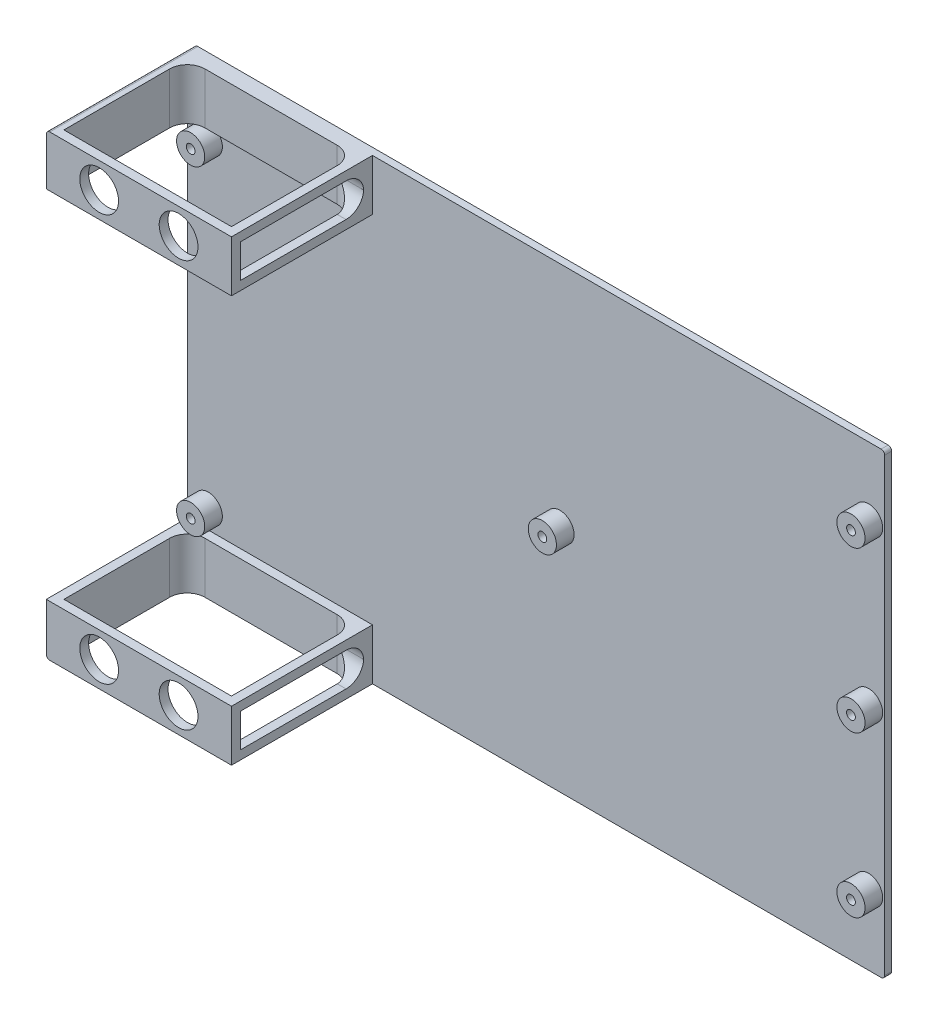
from build123d import *

# Parameters (mm, degrees)
SKETCH2_W                   = 197.834
SKETCH2_H                   = 129.822
BOSS_EXTRUDE1_DEPTH         = 2
SKETCH3_R                   = 4
BOSS_EXTRUDE2_DEPTH         = 5
TAP_DRILL_FOR_M3X0_5_TAP1_D = 2.5
SKETCH9_W                   = 52.531921718
SKETCH9_H                   = 14.5
BOSS_EXTRUDE3_DEPTH         = 40
CUT_EXTRUDE1_START          = -2.5
SKETCH11_W                  = 47.531921718
SKETCH11_H                  = 9.5
SKETCH11_H_2                = 2.5
SKETCH11_W_2                = 2.5
CUT_EXTRUDE1_DEPTH          = 35
CUT_EXTRUDE2_REACH          = 259.475
SKETCH12_R                  = 5.5
FILLET1_R                   = 5
FILLET1_OF_MIRROR1_R        = 5
FILLET2_R                   = 1


with BuildPart() as part:
    # Sketch2 → Boss-Extrude1 (new body)
    with BuildSketch(Plane(origin=(0, 0, 134.499543387), x_dir=(-1, 0, 0), z_dir=(0, 0, -1))):
        with Locations((-86.183818981, 109.06399149)):
            Rectangle(SKETCH2_W, SKETCH2_H)
    extrude(amount=BOSS_EXTRUDE1_DEPTH)

    # Sketch3 → Boss-Extrude2 (add)
    with BuildSketch(Plane.XY.offset(134.499543387)):
        with Locations((180.544818981, 154.78399149)):
            Circle(SKETCH3_R)
        with Locations((180.544818981, 109.38149149)):
            Circle(SKETCH3_R)
        with Locations((180.544818981, 63.97899149)):
            Circle(SKETCH3_R)
        with Locations((92.991018981, 109.38149149)):
            Circle(SKETCH3_R)
        with Locations((-6.780181019, 154.78399149)):
            Circle(SKETCH3_R)
        with Locations((-6.780181019, 63.97899149)):
            Circle(SKETCH3_R)
    extrude(amount=BOSS_EXTRUDE2_DEPTH)

    # Tap Drill for M3x0.5 Tap1 (through all)
    with Locations(Plane.XY.offset(139.499543387)):
        with Locations((180.544818981, 154.78399149), (180.544818981, 109.38149149), (180.544818981, 63.97899149), (92.991018981, 109.38149149), (-6.780181019, 63.97899149), (-6.780181019, 154.78399149)):
            Hole(TAP_DRILL_FOR_M3X0_5_TAP1_D / 2)

    # Sketch9 → Boss-Extrude3 (add)
    with BuildSketch(Plane.XY.offset(134.499543387)):
        with Locations((13.53277984, 166.72499149)):
            Rectangle(SKETCH9_W, SKETCH9_H)
    boss_extrude3 = extrude(amount=BOSS_EXTRUDE3_DEPTH)

    # Sketch11 → Cut-Extrude1 (cut)
    with BuildSketch(Plane.XY.offset(174.499543387).offset(CUT_EXTRUDE1_START)):
        with Locations((13.53277984, 166.72499149)):
            Rectangle(SKETCH11_W, SKETCH11_H)
        with Locations((13.53277984, 160.72499149)):
            Rectangle(SKETCH11_W, SKETCH11_H_2)
        with Locations((13.53277984, 172.72499149)):
            Rectangle(SKETCH11_W, SKETCH11_H_2)
        with Locations((38.548740699, 166.72499149)):
            Rectangle(SKETCH11_W_2, SKETCH11_H)
    cut_extrude1 = extrude(amount=-CUT_EXTRUDE1_DEPTH, mode=Mode.SUBTRACT)

    # Sketch12 → Cut-Extrude2 (cut, up to next)
    with BuildSketch(Plane.XY.offset(174.499543387), mode=Mode.PRIVATE) as cut_extrude2_sk1:
        with Locations((2.266818981, 166.72499149)):
            Circle(SKETCH12_R)
    cut_extrude2_tool1 = extrude(cut_extrude2_sk1.sketch, amount=-CUT_EXTRUDE2_REACH, mode=Mode.PRIVATE) & part.part
    # Sketch12 → Cut-Extrude2 (cut, up to next)
    with BuildSketch(Plane.XY.offset(174.499543387), mode=Mode.PRIVATE) as cut_extrude2_sk2:
        with Locations((24.798740699, 166.72499149)):
            Circle(SKETCH12_R)
    cut_extrude2_tool2 = extrude(cut_extrude2_sk2.sketch, amount=-CUT_EXTRUDE2_REACH, mode=Mode.PRIVATE) & part.part
    cut_extrude2_1 = cut_extrude2_tool1.solids().sort_by_distance((2.266819, 166.724991, 174.499543))[0]
    add(cut_extrude2_1, mode=Mode.SUBTRACT)
    cut_extrude2_2 = cut_extrude2_tool2.solids().sort_by_distance((24.798741, 166.724991, 174.499543))[0]
    add(cut_extrude2_2, mode=Mode.SUBTRACT)
    cut_extrude2 = cut_extrude2_1 + cut_extrude2_2  # Cut-Extrude2 as one shape, for the pattern or mirror that repeats it

    # Fillet1
    # the kernel refuses this fillet: 5 mm, written as the material it adds along each edge
    with BuildSketch(Plane(origin=(-10.233181019, 159.47499149, 136.999543387), x_dir=(0, 0, 1), z_dir=(0, 1, 0))) as fillet1_piece_1:
        with BuildLine():
            CenterArc((FILLET1_R, FILLET1_R), FILLET1_R, 180, 90)
            Line((0, FILLET1_R), (-FILLET1_R * 0.02, FILLET1_R))
            Line((-FILLET1_R * 0.02, FILLET1_R), (-FILLET1_R * 0.02, -FILLET1_R * 0.02))
            Line((-FILLET1_R * 0.02, -FILLET1_R * 0.02), (FILLET1_R, -FILLET1_R * 0.02))
            Line((FILLET1_R, -FILLET1_R * 0.02), (FILLET1_R, 0))
        make_face()
    extrude(amount=14.5)
    with BuildSketch(Plane(origin=(39.798740699, 171.47499149, 136.999543387), x_dir=(0, -1, 0), z_dir=(-1, 0, 0)), Plane(origin=(37.298740699, 171.47499149, 136.999543387), x_dir=(-1, 0, 0), z_dir=(0, 1, 0)), Plane(origin=(37.298740699, 161.97499149, 136.999543387), x_dir=(0, 1, 0), z_dir=(1, 0, 0)), Plane(origin=(37.298740699, 159.47499149, 136.999543387), x_dir=(-1, 0, 0), z_dir=(0, 1, 0))) as fillet1_piece_2:
        with BuildLine():
            CenterArc((FILLET1_R, FILLET1_R), FILLET1_R, 180, 90)
            Line((0, FILLET1_R), (-FILLET1_R * 0.02, FILLET1_R))
            Line((-FILLET1_R * 0.02, FILLET1_R), (-FILLET1_R * 0.02, -FILLET1_R * 0.02))
            Line((-FILLET1_R * 0.02, -FILLET1_R * 0.02), (FILLET1_R, -FILLET1_R * 0.02))
            Line((FILLET1_R, -FILLET1_R * 0.02), (FILLET1_R, 0))
        make_face()
    extrude(amount=2.5)
    with BuildSketch(Plane(origin=(39.798740699, 171.47499149, 136.999543387), x_dir=(0, -1, 0), z_dir=(-1, 0, 0))) as fillet1_piece_3a_section:
        with BuildLine():
            CenterArc((FILLET1_R, FILLET1_R), FILLET1_R, 180, 90)
            Line((0, FILLET1_R), (-FILLET1_R * 0.02, FILLET1_R))
            Line((-FILLET1_R * 0.02, FILLET1_R), (-FILLET1_R * 0.02, -FILLET1_R * 0.02))
            Line((-FILLET1_R * 0.02, -FILLET1_R * 0.02), (FILLET1_R, -FILLET1_R * 0.02))
            Line((FILLET1_R, -FILLET1_R * 0.02), (FILLET1_R, 0))
        make_face()
    fillet1_piece_3a = extrude(amount=15, mode=Mode.PRIVATE)
    fillet1_piece_3a = split(fillet1_piece_3a, bisect_by=Plane(origin=(37.298740699, 170.343015918, 138.131518958), z_dir=(-1, 0, 0)), keep=Keep.TOP, mode=Mode.PRIVATE)
    with BuildSketch(Plane(origin=(37.298740699, 158.97499149, 136.999543387), x_dir=(-1, 0, 0), z_dir=(0, 1, 0))) as fillet1_piece_3b_section:
        with BuildLine():
            CenterArc((FILLET1_R, FILLET1_R), FILLET1_R, 180, 90)
            Line((0, FILLET1_R), (-FILLET1_R * 0.02, FILLET1_R))
            Line((-FILLET1_R * 0.02, FILLET1_R), (-FILLET1_R * 0.02, -FILLET1_R * 0.02))
            Line((-FILLET1_R * 0.02, -FILLET1_R * 0.02), (FILLET1_R, -FILLET1_R * 0.02))
            Line((FILLET1_R, -FILLET1_R * 0.02), (FILLET1_R, 0))
        make_face()
    fillet1_piece_3b = extrude(amount=15, mode=Mode.PRIVATE)
    fillet1_piece_3b = split(fillet1_piece_3b, bisect_by=Plane(origin=(36.166765127, 171.47499149, 138.131518958), z_dir=(0, -1, 0)), keep=Keep.TOP, mode=Mode.PRIVATE)
    fillet1_piece_3 = fillet1_piece_3a & fillet1_piece_3b
    add(fillet1_piece_3)
    with BuildSketch(Plane(origin=(37.298740699, 159.47499149, 136.999543387), x_dir=(-1, 0, 0), z_dir=(0, 1, 0))) as fillet1_piece_4a_section:
        with BuildLine():
            CenterArc((FILLET1_R, FILLET1_R), FILLET1_R, 180, 90)
            Line((0, FILLET1_R), (-FILLET1_R * 0.02, FILLET1_R))
            Line((-FILLET1_R * 0.02, FILLET1_R), (-FILLET1_R * 0.02, -FILLET1_R * 0.02))
            Line((-FILLET1_R * 0.02, -FILLET1_R * 0.02), (FILLET1_R, -FILLET1_R * 0.02))
            Line((FILLET1_R, -FILLET1_R * 0.02), (FILLET1_R, 0))
        make_face()
    fillet1_piece_4a = extrude(amount=15, mode=Mode.PRIVATE)
    fillet1_piece_4a = split(fillet1_piece_4a, bisect_by=Plane(origin=(36.166765127, 161.97499149, 138.131518958), z_dir=(0, 1, 0)), keep=Keep.TOP, mode=Mode.PRIVATE)
    with BuildSketch(Plane(origin=(24.798740699, 161.97499149, 136.999543387), x_dir=(0, 1, 0), z_dir=(1, 0, 0))) as fillet1_piece_4b_section:
        with BuildLine():
            CenterArc((FILLET1_R, FILLET1_R), FILLET1_R, 180, 90)
            Line((0, FILLET1_R), (-FILLET1_R * 0.02, FILLET1_R))
            Line((-FILLET1_R * 0.02, FILLET1_R), (-FILLET1_R * 0.02, -FILLET1_R * 0.02))
            Line((-FILLET1_R * 0.02, -FILLET1_R * 0.02), (FILLET1_R, -FILLET1_R * 0.02))
            Line((FILLET1_R, -FILLET1_R * 0.02), (FILLET1_R, 0))
        make_face()
    fillet1_piece_4b = extrude(amount=15, mode=Mode.PRIVATE)
    fillet1_piece_4b = split(fillet1_piece_4b, bisect_by=Plane(origin=(37.298740699, 163.106967061, 138.131518958), z_dir=(-1, 0, 0)), keep=Keep.TOP, mode=Mode.PRIVATE)
    fillet1_piece_4 = fillet1_piece_4a & fillet1_piece_4b
    add(fillet1_piece_4)

    # Mirror1: Boss-Extrude3, Cut-Extrude1, Cut-Extrude2 across plane
    add(boss_extrude3.mirror(Plane.ZX.offset(109.06399149)))
    add(cut_extrude1.mirror(Plane.ZX.offset(109.06399149)), mode=Mode.SUBTRACT)
    add(cut_extrude2.mirror(Plane.ZX.offset(109.06399149)), mode=Mode.SUBTRACT)

    # Fillet1 of Mirror1
    # the kernel refuses this fillet: 5 mm, written as the material it adds along each edge
    with BuildSketch(Plane(origin=(-10.233181019, 58.65299149, 136.999543387), x_dir=(1, 0, 0), z_dir=(0, -1, 0))) as fillet1_of_mirror1_piece_1:
        with BuildLine():
            CenterArc((FILLET1_OF_MIRROR1_R, FILLET1_OF_MIRROR1_R), FILLET1_OF_MIRROR1_R, 180, 90)
            Line((0, FILLET1_OF_MIRROR1_R), (-FILLET1_OF_MIRROR1_R * 0.02, FILLET1_OF_MIRROR1_R))
            Line((-FILLET1_OF_MIRROR1_R * 0.02, FILLET1_OF_MIRROR1_R), (-FILLET1_OF_MIRROR1_R * 0.02, -FILLET1_OF_MIRROR1_R * 0.02))
            Line((-FILLET1_OF_MIRROR1_R * 0.02, -FILLET1_OF_MIRROR1_R * 0.02), (FILLET1_OF_MIRROR1_R, -FILLET1_OF_MIRROR1_R * 0.02))
            Line((FILLET1_OF_MIRROR1_R, -FILLET1_OF_MIRROR1_R * 0.02), (FILLET1_OF_MIRROR1_R, 0))
        make_face()
    extrude(amount=14.5)
    with BuildSketch(Plane(origin=(39.798740699, 46.65299149, 136.999543387), x_dir=(0, 1, 0), z_dir=(-1, 0, 0)), Plane(origin=(37.298740699, 56.15299149, 136.999543387), x_dir=(0, -1, 0), z_dir=(1, 0, 0)), Plane(origin=(37.298740699, 58.65299149, 136.999543387), x_dir=(-1, 0, 0), z_dir=(0, -1, 0))) as fillet1_of_mirror1_piece_2:
        with BuildLine():
            CenterArc((FILLET1_OF_MIRROR1_R, -FILLET1_OF_MIRROR1_R), FILLET1_OF_MIRROR1_R, 90, 90)
            Line((0, -FILLET1_OF_MIRROR1_R), (-FILLET1_OF_MIRROR1_R * 0.02, -FILLET1_OF_MIRROR1_R))
            Line((-FILLET1_OF_MIRROR1_R * 0.02, -FILLET1_OF_MIRROR1_R), (-FILLET1_OF_MIRROR1_R * 0.02, FILLET1_OF_MIRROR1_R * 0.02))
            Line((-FILLET1_OF_MIRROR1_R * 0.02, FILLET1_OF_MIRROR1_R * 0.02), (FILLET1_OF_MIRROR1_R, FILLET1_OF_MIRROR1_R * 0.02))
            Line((FILLET1_OF_MIRROR1_R, FILLET1_OF_MIRROR1_R * 0.02), (FILLET1_OF_MIRROR1_R, 0))
        make_face()
    extrude(amount=2.5)
    with BuildSketch(Plane(origin=(37.298740699, 46.65299149, 136.999543387), x_dir=(0, 0, 1), z_dir=(0, -1, 0))) as fillet1_of_mirror1_piece_3:
        with BuildLine():
            CenterArc((FILLET1_OF_MIRROR1_R, FILLET1_OF_MIRROR1_R), FILLET1_OF_MIRROR1_R, 180, 90)
            Line((0, FILLET1_OF_MIRROR1_R), (-FILLET1_OF_MIRROR1_R * 0.02, FILLET1_OF_MIRROR1_R))
            Line((-FILLET1_OF_MIRROR1_R * 0.02, FILLET1_OF_MIRROR1_R), (-FILLET1_OF_MIRROR1_R * 0.02, -FILLET1_OF_MIRROR1_R * 0.02))
            Line((-FILLET1_OF_MIRROR1_R * 0.02, -FILLET1_OF_MIRROR1_R * 0.02), (FILLET1_OF_MIRROR1_R, -FILLET1_OF_MIRROR1_R * 0.02))
            Line((FILLET1_OF_MIRROR1_R, -FILLET1_OF_MIRROR1_R * 0.02), (FILLET1_OF_MIRROR1_R, 0))
        make_face()
    extrude(amount=2.5)
    with BuildSketch(Plane(origin=(37.298740699, 59.15299149, 136.999543387), x_dir=(0, 0, 1), z_dir=(0, -1, 0))) as fillet1_of_mirror1_piece_4a_section:
        with BuildLine():
            CenterArc((FILLET1_OF_MIRROR1_R, FILLET1_OF_MIRROR1_R), FILLET1_OF_MIRROR1_R, 180, 90)
            Line((0, FILLET1_OF_MIRROR1_R), (-FILLET1_OF_MIRROR1_R * 0.02, FILLET1_OF_MIRROR1_R))
            Line((-FILLET1_OF_MIRROR1_R * 0.02, FILLET1_OF_MIRROR1_R), (-FILLET1_OF_MIRROR1_R * 0.02, -FILLET1_OF_MIRROR1_R * 0.02))
            Line((-FILLET1_OF_MIRROR1_R * 0.02, -FILLET1_OF_MIRROR1_R * 0.02), (FILLET1_OF_MIRROR1_R, -FILLET1_OF_MIRROR1_R * 0.02))
            Line((FILLET1_OF_MIRROR1_R, -FILLET1_OF_MIRROR1_R * 0.02), (FILLET1_OF_MIRROR1_R, 0))
        make_face()
    fillet1_of_mirror1_piece_4a = extrude(amount=15, mode=Mode.PRIVATE)
    fillet1_of_mirror1_piece_4a = split(fillet1_of_mirror1_piece_4a, bisect_by=Plane(origin=(36.166765127, 46.65299149, 138.131518958), z_dir=(0, 1, 0)), keep=Keep.TOP, mode=Mode.PRIVATE)
    with BuildSketch(Plane(origin=(39.798740699, 46.65299149, 136.999543387), x_dir=(0, 1, 0), z_dir=(-1, 0, 0))) as fillet1_of_mirror1_piece_4b_section:
        with BuildLine():
            CenterArc((FILLET1_OF_MIRROR1_R, -FILLET1_OF_MIRROR1_R), FILLET1_OF_MIRROR1_R, 90, 90)
            Line((0, -FILLET1_OF_MIRROR1_R), (-FILLET1_OF_MIRROR1_R * 0.02, -FILLET1_OF_MIRROR1_R))
            Line((-FILLET1_OF_MIRROR1_R * 0.02, -FILLET1_OF_MIRROR1_R), (-FILLET1_OF_MIRROR1_R * 0.02, FILLET1_OF_MIRROR1_R * 0.02))
            Line((-FILLET1_OF_MIRROR1_R * 0.02, FILLET1_OF_MIRROR1_R * 0.02), (FILLET1_OF_MIRROR1_R, FILLET1_OF_MIRROR1_R * 0.02))
            Line((FILLET1_OF_MIRROR1_R, FILLET1_OF_MIRROR1_R * 0.02), (FILLET1_OF_MIRROR1_R, 0))
        make_face()
    fillet1_of_mirror1_piece_4b = extrude(amount=15, mode=Mode.PRIVATE)
    fillet1_of_mirror1_piece_4b = split(fillet1_of_mirror1_piece_4b, bisect_by=Plane(origin=(37.298740699, 47.784967061, 138.131518958), z_dir=(-1, 0, 0)), keep=Keep.TOP, mode=Mode.PRIVATE)
    fillet1_of_mirror1_piece_4 = fillet1_of_mirror1_piece_4a & fillet1_of_mirror1_piece_4b
    add(fillet1_of_mirror1_piece_4)
    with BuildSketch(Plane(origin=(37.298740699, 58.65299149, 136.999543387), x_dir=(-1, 0, 0), z_dir=(0, -1, 0))) as fillet1_of_mirror1_piece_5a_section:
        with BuildLine():
            CenterArc((FILLET1_OF_MIRROR1_R, -FILLET1_OF_MIRROR1_R), FILLET1_OF_MIRROR1_R, 90, 90)
            Line((0, -FILLET1_OF_MIRROR1_R), (-FILLET1_OF_MIRROR1_R * 0.02, -FILLET1_OF_MIRROR1_R))
            Line((-FILLET1_OF_MIRROR1_R * 0.02, -FILLET1_OF_MIRROR1_R), (-FILLET1_OF_MIRROR1_R * 0.02, FILLET1_OF_MIRROR1_R * 0.02))
            Line((-FILLET1_OF_MIRROR1_R * 0.02, FILLET1_OF_MIRROR1_R * 0.02), (FILLET1_OF_MIRROR1_R, FILLET1_OF_MIRROR1_R * 0.02))
            Line((FILLET1_OF_MIRROR1_R, FILLET1_OF_MIRROR1_R * 0.02), (FILLET1_OF_MIRROR1_R, 0))
        make_face()
    fillet1_of_mirror1_piece_5a = extrude(amount=15, mode=Mode.PRIVATE)
    fillet1_of_mirror1_piece_5a = split(fillet1_of_mirror1_piece_5a, bisect_by=Plane(origin=(36.166765127, 56.15299149, 138.131518958), z_dir=(0, -1, 0)), keep=Keep.TOP, mode=Mode.PRIVATE)
    with BuildSketch(Plane(origin=(24.798740699, 56.15299149, 136.999543387), x_dir=(0, -1, 0), z_dir=(1, 0, 0))) as fillet1_of_mirror1_piece_5b_section:
        with BuildLine():
            CenterArc((FILLET1_OF_MIRROR1_R, -FILLET1_OF_MIRROR1_R), FILLET1_OF_MIRROR1_R, 90, 90)
            Line((0, -FILLET1_OF_MIRROR1_R), (-FILLET1_OF_MIRROR1_R * 0.02, -FILLET1_OF_MIRROR1_R))
            Line((-FILLET1_OF_MIRROR1_R * 0.02, -FILLET1_OF_MIRROR1_R), (-FILLET1_OF_MIRROR1_R * 0.02, FILLET1_OF_MIRROR1_R * 0.02))
            Line((-FILLET1_OF_MIRROR1_R * 0.02, FILLET1_OF_MIRROR1_R * 0.02), (FILLET1_OF_MIRROR1_R, FILLET1_OF_MIRROR1_R * 0.02))
            Line((FILLET1_OF_MIRROR1_R, FILLET1_OF_MIRROR1_R * 0.02), (FILLET1_OF_MIRROR1_R, 0))
        make_face()
    fillet1_of_mirror1_piece_5b = extrude(amount=15, mode=Mode.PRIVATE)
    fillet1_of_mirror1_piece_5b = split(fillet1_of_mirror1_piece_5b, bisect_by=Plane(origin=(37.298740699, 55.021015918, 138.131518958), z_dir=(-1, 0, 0)), keep=Keep.TOP, mode=Mode.PRIVATE)
    fillet1_of_mirror1_piece_5 = fillet1_of_mirror1_piece_5a & fillet1_of_mirror1_piece_5b
    add(fillet1_of_mirror1_piece_5)

    # Fillet2
    fillet2_edges = [part.edges().sort_by_distance(p)[0] for p in [
        (185.100818981, 173.97499149, 133.499543387),
        (-12.733181019, 173.97499149, 153.499543387),
        (-12.733181019, 44.15299149, 153.499543387),
        (185.100818981, 44.15299149, 133.499543387),
    ]]
    fillet(fillet2_edges, radius=FILLET2_R)


solid = part.part
